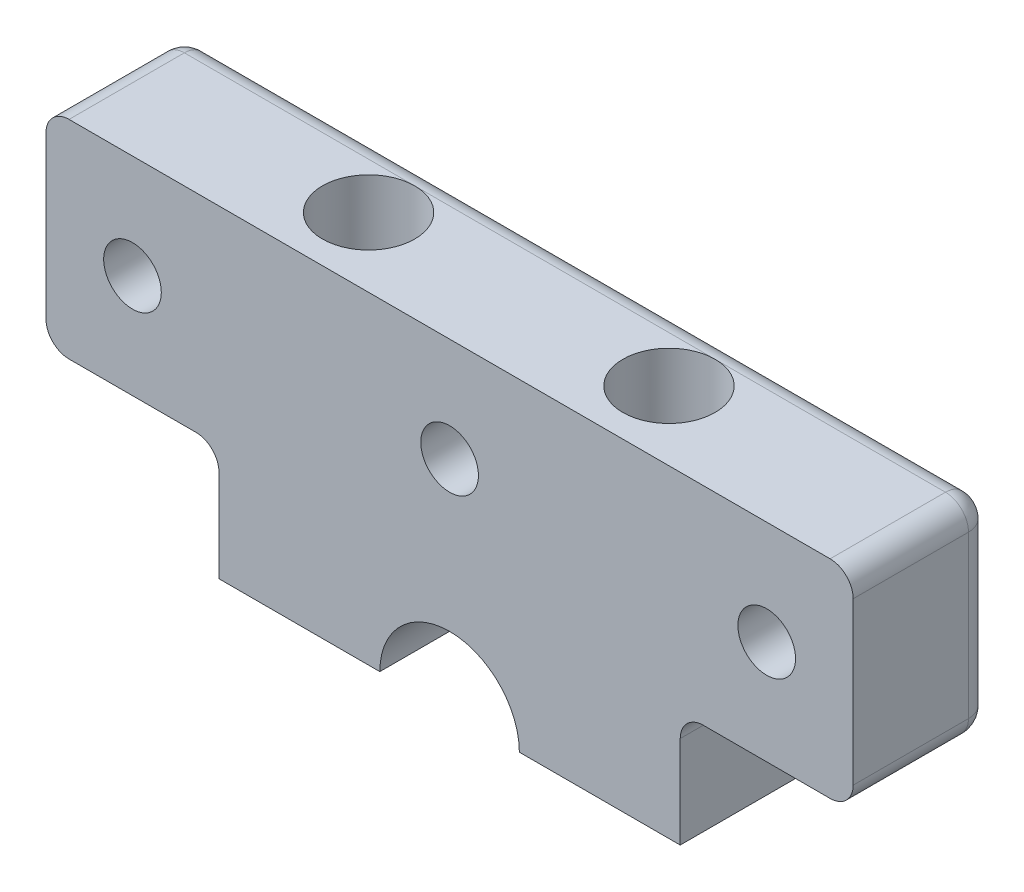
from build123d import *

# Parameters (mm, degrees)
ESQUISSE1_W             = 40
ESQUISSE1_H             = 18
BOSS_EXTRU_1_DEPTH      = 12
ESQUISSE2_W             = 40
ESQUISSE2_H             = 12
BOSS_EXTRU_2_DEPTH      = 10
ENL_V_MAT_EXTRU_1_DEPTH = 12
ESQUISSE4_R             = 2.5
ENL_V_MAT_EXTRU_2_DEPTH = 28
ESQUISSE5_R             = 2.5
ENL_V_MAT_EXTRU_3_DEPTH = 12
ESQUISSE6_R             = 4
ENL_V_MAT_EXTRU_5_DEPTH = 12
ESQUISSE7_W             = 12
ESQUISSE7_H             = 18
BOSS_EXTRU_3_DEPTH      = 15
ESQUISSE8_W             = 12
ESQUISSE8_H             = 18
BOSS_EXTRU_4_DEPTH      = 15
ESQUISSE9_R             = 2.5
ENL_V_MAT_EXTRU_6_DEPTH = 12
CONG_1_R                = 2


with BuildPart() as part:
    # Esquisse1 → Boss.-Extru.1 (new body)
    with BuildSketch(Plane.XY):
        with Locations((3.185612757, 0.725848564)):
            Rectangle(ESQUISSE1_W, ESQUISSE1_H)
    extrude(amount=BOSS_EXTRU_1_DEPTH)

    # Esquisse2 → Boss.-Extru.2 (add)
    with BuildSketch(Plane.XZ.offset(8.274151436)):
        with Locations((3.185612757, 6)):
            Rectangle(ESQUISSE2_W, ESQUISSE2_H)
    extrude(amount=BOSS_EXTRU_2_DEPTH)

    # Esquisse3 → Enlèv. mat.-Extru.1 (cut)
    with BuildSketch(Plane.XY.offset(12)):
        with BuildLine():
            Line((-2.864387243, -18.274151436), (9.235612757, -18.274151436))
            ThreePointArc((9.235612757, -18.274151436), (3.185612757, -12.224151436), (-2.864387243, -18.274151436))
        make_face()
    extrude(amount=-ENL_V_MAT_EXTRU_1_DEPTH, mode=Mode.SUBTRACT)

    # Esquisse4 → Enlèv. mat.-Extru.2 (cut)
    with BuildSketch(Plane.XZ.offset(18.274151436)):
        with Locations(Location((-9.839387243, 6, 0), (0, 0, 270))):
            Circle(ESQUISSE4_R)
        with Locations(Location((16.210612757, 6, 0), (0, 0, 270))):
            Circle(ESQUISSE4_R)
    extrude(amount=-ENL_V_MAT_EXTRU_2_DEPTH, mode=Mode.SUBTRACT)

    # Esquisse5 → Enlèv. mat.-Extru.3 (cut)
    with BuildSketch(Plane.XY.offset(12)):
        with Locations((3.185612757, 0.725848564)):
            Circle(ESQUISSE5_R)
    extrude(amount=-ENL_V_MAT_EXTRU_3_DEPTH, mode=Mode.SUBTRACT)

    # Esquisse6 → Enlèv. mat.-Extru.5 (cut)
    with BuildSketch(Plane(origin=(0, 9.725848564, 0), x_dir=(1, 0, 0), z_dir=(0, 1, 0))):
        with Locations(Location((16.210612757, -6, 0), (0, 0, 270))):
            Circle(ESQUISSE6_R)
        with Locations(Location((-9.839387243, -6, 0), (0, 0, 270))):
            Circle(ESQUISSE6_R)
    extrude(amount=-ENL_V_MAT_EXTRU_5_DEPTH, mode=Mode.SUBTRACT)

    # Esquisse7 → Boss.-Extru.3 (add)
    with BuildSketch(Plane.ZY.offset(16.814387243)):
        with Locations((6, 0.725848564)):
            Rectangle(ESQUISSE7_W, ESQUISSE7_H)
    extrude(amount=BOSS_EXTRU_3_DEPTH)

    # Esquisse8 → Boss.-Extru.4 (add)
    with BuildSketch(Plane(origin=(23.185612757, 0, 0), x_dir=(0, 0, -1), z_dir=(1, 0, 0))):
        with Locations((-6, 0.725848564)):
            Rectangle(ESQUISSE8_W, ESQUISSE8_H)
    extrude(amount=BOSS_EXTRU_4_DEPTH)

    # Esquisse9 → Enlèv. mat.-Extru.6 (cut)
    with BuildSketch(Plane.XY.offset(12)):
        with Locations((-24.314387243, 0.725848564)):
            Circle(ESQUISSE9_R)
        with Locations((30.685612757, 0.725848564)):
            Circle(ESQUISSE9_R)
    extrude(amount=-ENL_V_MAT_EXTRU_6_DEPTH, mode=Mode.SUBTRACT)

    # Congé1
    cong_1_edges = [part.edges().sort_by_distance(p)[0] for p in [
        (3.185612757, 9.725848564, 0),
        (23.185612757, -13.274151436, 0),
        (-16.814387243, -13.274151436, 0),
        (-16.814387243, -8.274151436, 6),
        (-24.314387243, -8.274151436, 0),
        (-31.814387243, 0.725848564, 0),
        (-31.814387243, -8.274151436, 6),
        (-31.814387243, 9.725848564, 6),
        (30.685612757, -8.274151436, 0),
        (23.185612757, -8.274151436, 6),
        (38.185612757, 0.725848564, 0),
        (38.185612757, 9.725848564, 6),
        (38.185612757, -8.274151436, 6),
    ]]
    fillet(cong_1_edges, radius=CONG_1_R - 0.0001)  # a hair under: the kernel refuses the full size


solid = part.part
